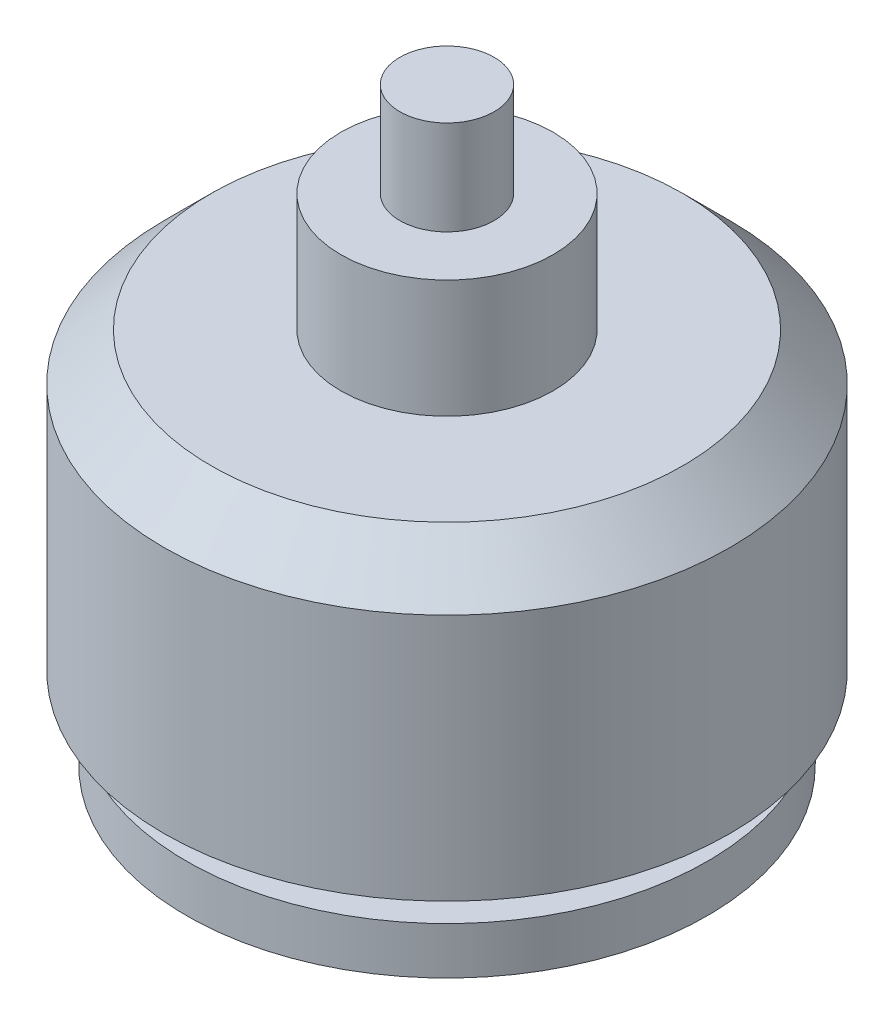
from build123d import *


with BuildPart() as part:
    # Sketch1 → Revolve1 (revolve)
    with BuildSketch(Plane.XY):
        Polygon((0, 0), (22.08, 0), (22.08, 4), (16.8, 4), (16.8, 7), (24, 7), (24, 28), (20, 32), (9, 32), (9, 42), (4, 42), (4, 50), (0, 50), align=None)
    revolve(axis=Axis((0, -10, 0), (0, 1, 0)))


solid = part.part
